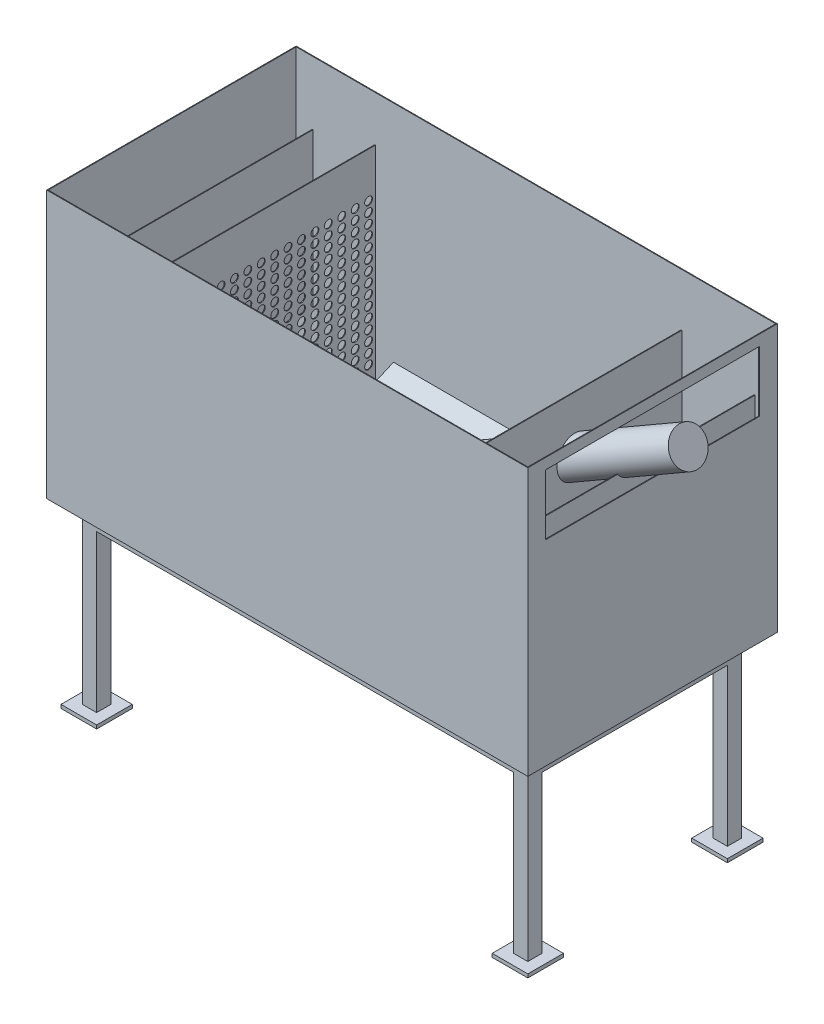
from build123d import *

# Parameters (mm, degrees)
MASTER_FOOTPRINT_W                  = 1350
MASTER_FOOTPRINT_H                  = 700
BATH_BASE_PLATE_DEPTH               = 750
BATH_SHELL_2MM_T                    = -2
SKETCH_1_R                          = 50
INLET_D100_OPENING_DEPTH            = 10
INLET_IMPACT_BAFFLE_START           = 125
SKETCH_2_W                          = 540
SKETCH_2_H                          = 430
INLET_IMPACT_BAFFLE_DEPTH           = 2
DISTRIBUTOR_D22_START               = 250
SKETCH_3_W                          = 640
SKETCH_3_H                          = 648
SKETCH_3_R                          = 11
DISTRIBUTOR_D22_DEPTH               = 2
OUTLET_SUBMERGED_BAFFLE_START       = 1130
SKETCH_4_W                          = 600
SKETCH_4_H                          = 330
OUTLET_SUBMERGED_BAFFLE_DEPTH       = 2
OVERFLOW_WEIR_Z550_START            = 1290
SKETCH_5_W                          = 690
SKETCH_5_H                          = 548
OVERFLOW_WEIR_Z550_DEPTH            = 2
OUTLET_WEIR_SLOT_W600_START         = 1345
SKETCH_6_W                          = 600
SKETCH_6_H                          = 170
OUTLET_WEIR_SLOT_W600_DEPTH         = 10
SLOPED_SEDIMENT_FLOOR_START         = 275
SLOPED_SEDIMENT_FLOOR_DEPTH         = 825
SKETCH_8_W                          = 40
SKETCH_8_H                          = 40
FRAME_LEGS_40X40_H500_DEPTH         = 500
FRAME_LONGITUDINAL_RAILS_START      = -20
SKETCH_9_W                          = 1250
SKETCH_9_H                          = 40
FRAME_LONGITUDINAL_RAILS_DEPTH      = 40
FRAME_TRANSVERSE_RAILS_START        = -20
SKETCH_10_W                         = 40
SKETCH_10_H                         = 520
FRAME_TRANSVERSE_RAILS_DEPTH        = 40
FRAME_FOOT_PADS_100X100_START       = -500
SKETCH_11_W                         = 100
SKETCH_11_H                         = 100
FRAME_FOOT_PADS_100X100_DEPTH       = 10
SCREW_OUTER_ENVELOPE_D100_PROFILE_R = 50


with BuildPart() as part:
    # MASTER_FOOTPRINT → BATH_BASE_PLATE (new body)
    with BuildSketch(Plane(origin=(0, 0, 0), x_dir=(1, 0, 0), z_dir=(0, 1, 0))):
        with Locations((675, 350)):
            Rectangle(MASTER_FOOTPRINT_W, MASTER_FOOTPRINT_H)
    extrude(amount=BATH_BASE_PLATE_DEPTH)

    # BATH_SHELL_2MM
    bath_shell_2mm_openings = [part.faces().sort_by_distance(p)[0] for p in [
        (675, 750, -350),
    ]]
    offset(amount=BATH_SHELL_2MM_T, openings=bath_shell_2mm_openings, kind=Kind.INTERSECTION)

    # Эскиз1 → INLET_D100_OPENING (cut)
    with BuildSketch(Plane(origin=(0, 0, 0), x_dir=(0, 0, -1), z_dir=(1, 0, 0))):
        with Locations((350, 420)):
            Circle(SKETCH_1_R)
    extrude(amount=INLET_D100_OPENING_DEPTH, mode=Mode.SUBTRACT)

    # Эскиз6 → OUTLET_WEIR_SLOT_W600 (cut)
    with BuildSketch(Plane(origin=(0, 0, 0), x_dir=(0, 0, -1), z_dir=(1, 0, 0)).offset(OUTLET_WEIR_SLOT_W600_START)):
        with Locations((350, 635)):
            Rectangle(SKETCH_6_W, SKETCH_6_H)
    extrude(amount=OUTLET_WEIR_SLOT_W600_DEPTH, mode=Mode.SUBTRACT)

    # Эскиз7 → SLOPED_SEDIMENT_FLOOR (add)
    with BuildSketch(Plane(origin=(0, 0, 0), x_dir=(0, 0, -1), z_dir=(1, 0, 0)).offset(SLOPED_SEDIMENT_FLOOR_START)):
        Polygon((2, -1), (2, 120), (280, -1), align=None)
        Polygon((698, -1), (698, 120), (420, -1), align=None)
    extrude(amount=SLOPED_SEDIMENT_FLOOR_DEPTH)

    # Эскиз8 → FRAME_LEGS_40X40_H500 (add)
    with BuildSketch(Plane(origin=(0, 0, 0), x_dir=(1, 0, 0), z_dir=(0, 1, 0))):
        with Locations((70, 70)):
            Rectangle(SKETCH_8_W, SKETCH_8_H)
        with Locations((70, 630)):
            Rectangle(SKETCH_8_W, SKETCH_8_H)
        with Locations((1280, 70)):
            Rectangle(SKETCH_8_W, SKETCH_8_H)
        with Locations((1280, 630)):
            Rectangle(SKETCH_8_W, SKETCH_8_H)
    extrude(amount=-FRAME_LEGS_40X40_H500_DEPTH)

    # Эскиз9 → FRAME_LONGITUDINAL_RAILS (add)
    with BuildSketch(Plane(origin=(0, 0, 0), x_dir=(1, 0, 0), z_dir=(0, 1, 0)).offset(FRAME_LONGITUDINAL_RAILS_START)):
        with Locations((675, 70)):
            Rectangle(SKETCH_9_W, SKETCH_9_H)
        with Locations((675, 630)):
            Rectangle(SKETCH_9_W, SKETCH_9_H)
    extrude(amount=-FRAME_LONGITUDINAL_RAILS_DEPTH)

    # Эскиз10 → FRAME_TRANSVERSE_RAILS (add)
    with BuildSketch(Plane(origin=(0, 0, 0), x_dir=(1, 0, 0), z_dir=(0, 1, 0)).offset(FRAME_TRANSVERSE_RAILS_START)):
        with Locations((70, 350)):
            Rectangle(SKETCH_10_W, SKETCH_10_H)
        with Locations((1280, 350)):
            Rectangle(SKETCH_10_W, SKETCH_10_H)
    extrude(amount=-FRAME_TRANSVERSE_RAILS_DEPTH)

    # Эскиз11 → FRAME_FOOT_PADS_100X100 (add)
    with BuildSketch(Plane(origin=(0, 0, 0), x_dir=(1, 0, 0), z_dir=(0, 1, 0)).offset(FRAME_FOOT_PADS_100X100_START)):
        with Locations((70, 70)):
            Rectangle(SKETCH_11_W, SKETCH_11_H)
        with Locations((70, 630)):
            Rectangle(SKETCH_11_W, SKETCH_11_H)
        with Locations((1280, 70)):
            Rectangle(SKETCH_11_W, SKETCH_11_H)
        with Locations((1280, 630)):
            Rectangle(SKETCH_11_W, SKETCH_11_H)
    extrude(amount=-FRAME_FOOT_PADS_100X100_DEPTH)


with BuildPart() as body_2:
    # Эскиз2 → INLET_IMPACT_BAFFLE (new body)
    with BuildSketch(Plane(origin=(0, 0, 0), x_dir=(0, 0, -1), z_dir=(1, 0, 0)).offset(INLET_IMPACT_BAFFLE_START)):
        with Locations((350, 435)):
            Rectangle(SKETCH_2_W, SKETCH_2_H)
    extrude(amount=INLET_IMPACT_BAFFLE_DEPTH)


with BuildPart() as body_3:
    # Эскиз3 → DISTRIBUTOR_D22 (new body)
    with BuildSketch(Plane(origin=(0, 0, 0), x_dir=(0, 0, -1), z_dir=(1, 0, 0)).offset(DISTRIBUTOR_D22_START)):
        with Locations((350, 326)):
            Rectangle(SKETCH_3_W, SKETCH_3_H)
        with Locations((48.823529412, 125)):
            Circle(SKETCH_3_R, mode=Mode.SUBTRACT)
        with Locations((48.823529412, 153.5)):
            Circle(SKETCH_3_R, mode=Mode.SUBTRACT)
        with Locations((48.823529412, 182)):
            Circle(SKETCH_3_R, mode=Mode.SUBTRACT)
        with Locations((48.823529412, 210.5)):
            Circle(SKETCH_3_R, mode=Mode.SUBTRACT)
        with Locations((48.823529412, 239)):
            Circle(SKETCH_3_R, mode=Mode.SUBTRACT)
        with Locations((48.823529412, 267.5)):
            Circle(SKETCH_3_R, mode=Mode.SUBTRACT)
        with Locations((48.823529412, 296)):
            Circle(SKETCH_3_R, mode=Mode.SUBTRACT)
        with Locations((48.823529412, 324.5)):
            Circle(SKETCH_3_R, mode=Mode.SUBTRACT)
        with Locations((48.823529412, 353)):
            Circle(SKETCH_3_R, mode=Mode.SUBTRACT)
        with Locations((48.823529412, 381.5)):
            Circle(SKETCH_3_R, mode=Mode.SUBTRACT)
        with Locations((48.823529412, 410)):
            Circle(SKETCH_3_R, mode=Mode.SUBTRACT)
        with Locations((48.823529412, 438.5)):
            Circle(SKETCH_3_R, mode=Mode.SUBTRACT)
        with Locations((48.823529412, 467)):
            Circle(SKETCH_3_R, mode=Mode.SUBTRACT)
        with Locations((48.823529412, 495.5)):
            Circle(SKETCH_3_R, mode=Mode.SUBTRACT)
        with Locations((48.823529412, 524)):
            Circle(SKETCH_3_R, mode=Mode.SUBTRACT)
        with Locations((86.470588235, 125)):
            Circle(SKETCH_3_R, mode=Mode.SUBTRACT)
        with Locations((86.470588235, 153.5)):
            Circle(SKETCH_3_R, mode=Mode.SUBTRACT)
        with Locations((86.470588235, 182)):
            Circle(SKETCH_3_R, mode=Mode.SUBTRACT)
        with Locations((86.470588235, 210.5)):
            Circle(SKETCH_3_R, mode=Mode.SUBTRACT)
        with Locations((86.470588235, 239)):
            Circle(SKETCH_3_R, mode=Mode.SUBTRACT)
        with Locations((86.470588235, 267.5)):
            Circle(SKETCH_3_R, mode=Mode.SUBTRACT)
        with Locations((86.470588235, 296)):
            Circle(SKETCH_3_R, mode=Mode.SUBTRACT)
        with Locations((86.470588235, 324.5)):
            Circle(SKETCH_3_R, mode=Mode.SUBTRACT)
        with Locations((86.470588235, 353)):
            Circle(SKETCH_3_R, mode=Mode.SUBTRACT)
        with Locations((86.470588235, 381.5)):
            Circle(SKETCH_3_R, mode=Mode.SUBTRACT)
        with Locations((86.470588235, 410)):
            Circle(SKETCH_3_R, mode=Mode.SUBTRACT)
        with Locations((86.470588235, 438.5)):
            Circle(SKETCH_3_R, mode=Mode.SUBTRACT)
        with Locations((86.470588235, 467)):
            Circle(SKETCH_3_R, mode=Mode.SUBTRACT)
        with Locations((86.470588235, 495.5)):
            Circle(SKETCH_3_R, mode=Mode.SUBTRACT)
        with Locations((86.470588235, 524)):
            Circle(SKETCH_3_R, mode=Mode.SUBTRACT)
        with Locations((124.117647059, 125)):
            Circle(SKETCH_3_R, mode=Mode.SUBTRACT)
        with Locations((124.117647059, 153.5)):
            Circle(SKETCH_3_R, mode=Mode.SUBTRACT)
        with Locations((124.117647059, 182)):
            Circle(SKETCH_3_R, mode=Mode.SUBTRACT)
        with Locations((124.117647059, 210.5)):
            Circle(SKETCH_3_R, mode=Mode.SUBTRACT)
        with Locations((124.117647059, 239)):
            Circle(SKETCH_3_R, mode=Mode.SUBTRACT)
        with Locations((124.117647059, 267.5)):
            Circle(SKETCH_3_R, mode=Mode.SUBTRACT)
        with Locations((124.117647059, 296)):
            Circle(SKETCH_3_R, mode=Mode.SUBTRACT)
        with Locations((124.117647059, 324.5)):
            Circle(SKETCH_3_R, mode=Mode.SUBTRACT)
        with Locations((124.117647059, 353)):
            Circle(SKETCH_3_R, mode=Mode.SUBTRACT)
        with Locations((124.117647059, 381.5)):
            Circle(SKETCH_3_R, mode=Mode.SUBTRACT)
        with Locations((124.117647059, 410)):
            Circle(SKETCH_3_R, mode=Mode.SUBTRACT)
        with Locations((124.117647059, 438.5)):
            Circle(SKETCH_3_R, mode=Mode.SUBTRACT)
        with Locations((124.117647059, 467)):
            Circle(SKETCH_3_R, mode=Mode.SUBTRACT)
        with Locations((124.117647059, 495.5)):
            Circle(SKETCH_3_R, mode=Mode.SUBTRACT)
        with Locations((124.117647059, 524)):
            Circle(SKETCH_3_R, mode=Mode.SUBTRACT)
        with Locations((161.764705882, 125)):
            Circle(SKETCH_3_R, mode=Mode.SUBTRACT)
        with Locations((161.764705882, 153.5)):
            Circle(SKETCH_3_R, mode=Mode.SUBTRACT)
        with Locations((161.764705882, 182)):
            Circle(SKETCH_3_R, mode=Mode.SUBTRACT)
        with Locations((161.764705882, 210.5)):
            Circle(SKETCH_3_R, mode=Mode.SUBTRACT)
        with Locations((161.764705882, 239)):
            Circle(SKETCH_3_R, mode=Mode.SUBTRACT)
        with Locations((161.764705882, 267.5)):
            Circle(SKETCH_3_R, mode=Mode.SUBTRACT)
        with Locations((161.764705882, 296)):
            Circle(SKETCH_3_R, mode=Mode.SUBTRACT)
        with Locations((161.764705882, 324.5)):
            Circle(SKETCH_3_R, mode=Mode.SUBTRACT)
        with Locations((161.764705882, 353)):
            Circle(SKETCH_3_R, mode=Mode.SUBTRACT)
        with Locations((161.764705882, 381.5)):
            Circle(SKETCH_3_R, mode=Mode.SUBTRACT)
        with Locations((161.764705882, 410)):
            Circle(SKETCH_3_R, mode=Mode.SUBTRACT)
        with Locations((161.764705882, 438.5)):
            Circle(SKETCH_3_R, mode=Mode.SUBTRACT)
        with Locations((161.764705882, 467)):
            Circle(SKETCH_3_R, mode=Mode.SUBTRACT)
        with Locations((161.764705882, 495.5)):
            Circle(SKETCH_3_R, mode=Mode.SUBTRACT)
        with Locations((161.764705882, 524)):
            Circle(SKETCH_3_R, mode=Mode.SUBTRACT)
        with Locations((199.411764706, 125)):
            Circle(SKETCH_3_R, mode=Mode.SUBTRACT)
        with Locations((199.411764706, 153.5)):
            Circle(SKETCH_3_R, mode=Mode.SUBTRACT)
        with Locations((199.411764706, 182)):
            Circle(SKETCH_3_R, mode=Mode.SUBTRACT)
        with Locations((199.411764706, 210.5)):
            Circle(SKETCH_3_R, mode=Mode.SUBTRACT)
        with Locations((199.411764706, 239)):
            Circle(SKETCH_3_R, mode=Mode.SUBTRACT)
        with Locations((199.411764706, 267.5)):
            Circle(SKETCH_3_R, mode=Mode.SUBTRACT)
        with Locations((199.411764706, 296)):
            Circle(SKETCH_3_R, mode=Mode.SUBTRACT)
        with Locations((199.411764706, 324.5)):
            Circle(SKETCH_3_R, mode=Mode.SUBTRACT)
        with Locations((199.411764706, 353)):
            Circle(SKETCH_3_R, mode=Mode.SUBTRACT)
        with Locations((199.411764706, 381.5)):
            Circle(SKETCH_3_R, mode=Mode.SUBTRACT)
        with Locations((199.411764706, 410)):
            Circle(SKETCH_3_R, mode=Mode.SUBTRACT)
        with Locations((199.411764706, 438.5)):
            Circle(SKETCH_3_R, mode=Mode.SUBTRACT)
        with Locations((199.411764706, 467)):
            Circle(SKETCH_3_R, mode=Mode.SUBTRACT)
        with Locations((199.411764706, 495.5)):
            Circle(SKETCH_3_R, mode=Mode.SUBTRACT)
        with Locations((199.411764706, 524)):
            Circle(SKETCH_3_R, mode=Mode.SUBTRACT)
        with Locations((237.058823529, 125)):
            Circle(SKETCH_3_R, mode=Mode.SUBTRACT)
        with Locations((237.058823529, 153.5)):
            Circle(SKETCH_3_R, mode=Mode.SUBTRACT)
        with Locations((237.058823529, 182)):
            Circle(SKETCH_3_R, mode=Mode.SUBTRACT)
        with Locations((237.058823529, 210.5)):
            Circle(SKETCH_3_R, mode=Mode.SUBTRACT)
        with Locations((237.058823529, 239)):
            Circle(SKETCH_3_R, mode=Mode.SUBTRACT)
        with Locations((237.058823529, 267.5)):
            Circle(SKETCH_3_R, mode=Mode.SUBTRACT)
        with Locations((237.058823529, 296)):
            Circle(SKETCH_3_R, mode=Mode.SUBTRACT)
        with Locations((237.058823529, 324.5)):
            Circle(SKETCH_3_R, mode=Mode.SUBTRACT)
        with Locations((237.058823529, 353)):
            Circle(SKETCH_3_R, mode=Mode.SUBTRACT)
        with Locations((237.058823529, 381.5)):
            Circle(SKETCH_3_R, mode=Mode.SUBTRACT)
        with Locations((237.058823529, 410)):
            Circle(SKETCH_3_R, mode=Mode.SUBTRACT)
        with Locations((237.058823529, 438.5)):
            Circle(SKETCH_3_R, mode=Mode.SUBTRACT)
        with Locations((237.058823529, 467)):
            Circle(SKETCH_3_R, mode=Mode.SUBTRACT)
        with Locations((237.058823529, 495.5)):
            Circle(SKETCH_3_R, mode=Mode.SUBTRACT)
        with Locations((237.058823529, 524)):
            Circle(SKETCH_3_R, mode=Mode.SUBTRACT)
        with Locations((274.705882353, 125)):
            Circle(SKETCH_3_R, mode=Mode.SUBTRACT)
        with Locations((274.705882353, 153.5)):
            Circle(SKETCH_3_R, mode=Mode.SUBTRACT)
        with Locations((274.705882353, 182)):
            Circle(SKETCH_3_R, mode=Mode.SUBTRACT)
        with Locations((274.705882353, 210.5)):
            Circle(SKETCH_3_R, mode=Mode.SUBTRACT)
        with Locations((274.705882353, 239)):
            Circle(SKETCH_3_R, mode=Mode.SUBTRACT)
        with Locations((274.705882353, 267.5)):
            Circle(SKETCH_3_R, mode=Mode.SUBTRACT)
        with Locations((274.705882353, 296)):
            Circle(SKETCH_3_R, mode=Mode.SUBTRACT)
        with Locations((274.705882353, 324.5)):
            Circle(SKETCH_3_R, mode=Mode.SUBTRACT)
        with Locations((274.705882353, 353)):
            Circle(SKETCH_3_R, mode=Mode.SUBTRACT)
        with Locations((274.705882353, 381.5)):
            Circle(SKETCH_3_R, mode=Mode.SUBTRACT)
        with Locations((274.705882353, 410)):
            Circle(SKETCH_3_R, mode=Mode.SUBTRACT)
        with Locations((274.705882353, 438.5)):
            Circle(SKETCH_3_R, mode=Mode.SUBTRACT)
        with Locations((274.705882353, 467)):
            Circle(SKETCH_3_R, mode=Mode.SUBTRACT)
        with Locations((274.705882353, 495.5)):
            Circle(SKETCH_3_R, mode=Mode.SUBTRACT)
        with Locations((274.705882353, 524)):
            Circle(SKETCH_3_R, mode=Mode.SUBTRACT)
        with Locations((312.352941176, 125)):
            Circle(SKETCH_3_R, mode=Mode.SUBTRACT)
        with Locations((312.352941176, 153.5)):
            Circle(SKETCH_3_R, mode=Mode.SUBTRACT)
        with Locations((312.352941176, 182)):
            Circle(SKETCH_3_R, mode=Mode.SUBTRACT)
        with Locations((312.352941176, 210.5)):
            Circle(SKETCH_3_R, mode=Mode.SUBTRACT)
        with Locations((312.352941176, 239)):
            Circle(SKETCH_3_R, mode=Mode.SUBTRACT)
        with Locations((312.352941176, 267.5)):
            Circle(SKETCH_3_R, mode=Mode.SUBTRACT)
        with Locations((312.352941176, 296)):
            Circle(SKETCH_3_R, mode=Mode.SUBTRACT)
        with Locations((312.352941176, 324.5)):
            Circle(SKETCH_3_R, mode=Mode.SUBTRACT)
        with Locations((312.352941176, 353)):
            Circle(SKETCH_3_R, mode=Mode.SUBTRACT)
        with Locations((312.352941176, 381.5)):
            Circle(SKETCH_3_R, mode=Mode.SUBTRACT)
        with Locations((312.352941176, 410)):
            Circle(SKETCH_3_R, mode=Mode.SUBTRACT)
        with Locations((312.352941176, 438.5)):
            Circle(SKETCH_3_R, mode=Mode.SUBTRACT)
        with Locations((312.352941176, 467)):
            Circle(SKETCH_3_R, mode=Mode.SUBTRACT)
        with Locations((312.352941176, 495.5)):
            Circle(SKETCH_3_R, mode=Mode.SUBTRACT)
        with Locations((312.352941176, 524)):
            Circle(SKETCH_3_R, mode=Mode.SUBTRACT)
        with Locations((350, 125)):
            Circle(SKETCH_3_R, mode=Mode.SUBTRACT)
        with Locations((350, 153.5)):
            Circle(SKETCH_3_R, mode=Mode.SUBTRACT)
        with Locations((350, 182)):
            Circle(SKETCH_3_R, mode=Mode.SUBTRACT)
        with Locations((350, 210.5)):
            Circle(SKETCH_3_R, mode=Mode.SUBTRACT)
        with Locations((350, 239)):
            Circle(SKETCH_3_R, mode=Mode.SUBTRACT)
        with Locations((350, 267.5)):
            Circle(SKETCH_3_R, mode=Mode.SUBTRACT)
        with Locations((350, 296)):
            Circle(SKETCH_3_R, mode=Mode.SUBTRACT)
        with Locations((350, 324.5)):
            Circle(SKETCH_3_R, mode=Mode.SUBTRACT)
        with Locations((350, 353)):
            Circle(SKETCH_3_R, mode=Mode.SUBTRACT)
        with Locations((350, 381.5)):
            Circle(SKETCH_3_R, mode=Mode.SUBTRACT)
        with Locations((350, 410)):
            Circle(SKETCH_3_R, mode=Mode.SUBTRACT)
        with Locations((350, 438.5)):
            Circle(SKETCH_3_R, mode=Mode.SUBTRACT)
        with Locations((350, 467)):
            Circle(SKETCH_3_R, mode=Mode.SUBTRACT)
        with Locations((350, 495.5)):
            Circle(SKETCH_3_R, mode=Mode.SUBTRACT)
        with Locations((350, 524)):
            Circle(SKETCH_3_R, mode=Mode.SUBTRACT)
        with Locations((387.647058824, 125)):
            Circle(SKETCH_3_R, mode=Mode.SUBTRACT)
        with Locations((387.647058824, 153.5)):
            Circle(SKETCH_3_R, mode=Mode.SUBTRACT)
        with Locations((387.647058824, 182)):
            Circle(SKETCH_3_R, mode=Mode.SUBTRACT)
        with Locations((387.647058824, 210.5)):
            Circle(SKETCH_3_R, mode=Mode.SUBTRACT)
        with Locations((387.647058824, 239)):
            Circle(SKETCH_3_R, mode=Mode.SUBTRACT)
        with Locations((387.647058824, 267.5)):
            Circle(SKETCH_3_R, mode=Mode.SUBTRACT)
        with Locations((387.647058824, 296)):
            Circle(SKETCH_3_R, mode=Mode.SUBTRACT)
        with Locations((387.647058824, 324.5)):
            Circle(SKETCH_3_R, mode=Mode.SUBTRACT)
        with Locations((387.647058824, 353)):
            Circle(SKETCH_3_R, mode=Mode.SUBTRACT)
        with Locations((387.647058824, 381.5)):
            Circle(SKETCH_3_R, mode=Mode.SUBTRACT)
        with Locations((387.647058824, 410)):
            Circle(SKETCH_3_R, mode=Mode.SUBTRACT)
        with Locations((387.647058824, 438.5)):
            Circle(SKETCH_3_R, mode=Mode.SUBTRACT)
        with Locations((387.647058824, 467)):
            Circle(SKETCH_3_R, mode=Mode.SUBTRACT)
        with Locations((387.647058824, 495.5)):
            Circle(SKETCH_3_R, mode=Mode.SUBTRACT)
        with Locations((387.647058824, 524)):
            Circle(SKETCH_3_R, mode=Mode.SUBTRACT)
        with Locations((425.294117647, 125)):
            Circle(SKETCH_3_R, mode=Mode.SUBTRACT)
        with Locations((425.294117647, 153.5)):
            Circle(SKETCH_3_R, mode=Mode.SUBTRACT)
        with Locations((425.294117647, 182)):
            Circle(SKETCH_3_R, mode=Mode.SUBTRACT)
        with Locations((425.294117647, 210.5)):
            Circle(SKETCH_3_R, mode=Mode.SUBTRACT)
        with Locations((425.294117647, 239)):
            Circle(SKETCH_3_R, mode=Mode.SUBTRACT)
        with Locations((425.294117647, 267.5)):
            Circle(SKETCH_3_R, mode=Mode.SUBTRACT)
        with Locations((425.294117647, 296)):
            Circle(SKETCH_3_R, mode=Mode.SUBTRACT)
        with Locations((425.294117647, 324.5)):
            Circle(SKETCH_3_R, mode=Mode.SUBTRACT)
        with Locations((425.294117647, 353)):
            Circle(SKETCH_3_R, mode=Mode.SUBTRACT)
        with Locations((425.294117647, 381.5)):
            Circle(SKETCH_3_R, mode=Mode.SUBTRACT)
        with Locations((425.294117647, 410)):
            Circle(SKETCH_3_R, mode=Mode.SUBTRACT)
        with Locations((425.294117647, 438.5)):
            Circle(SKETCH_3_R, mode=Mode.SUBTRACT)
        with Locations((425.294117647, 467)):
            Circle(SKETCH_3_R, mode=Mode.SUBTRACT)
        with Locations((425.294117647, 495.5)):
            Circle(SKETCH_3_R, mode=Mode.SUBTRACT)
        with Locations((425.294117647, 524)):
            Circle(SKETCH_3_R, mode=Mode.SUBTRACT)
        with Locations((462.941176471, 125)):
            Circle(SKETCH_3_R, mode=Mode.SUBTRACT)
        with Locations((462.941176471, 153.5)):
            Circle(SKETCH_3_R, mode=Mode.SUBTRACT)
        with Locations((462.941176471, 182)):
            Circle(SKETCH_3_R, mode=Mode.SUBTRACT)
        with Locations((462.941176471, 210.5)):
            Circle(SKETCH_3_R, mode=Mode.SUBTRACT)
        with Locations((462.941176471, 239)):
            Circle(SKETCH_3_R, mode=Mode.SUBTRACT)
        with Locations((462.941176471, 267.5)):
            Circle(SKETCH_3_R, mode=Mode.SUBTRACT)
        with Locations((462.941176471, 296)):
            Circle(SKETCH_3_R, mode=Mode.SUBTRACT)
        with Locations((462.941176471, 324.5)):
            Circle(SKETCH_3_R, mode=Mode.SUBTRACT)
        with Locations((462.941176471, 353)):
            Circle(SKETCH_3_R, mode=Mode.SUBTRACT)
        with Locations((462.941176471, 381.5)):
            Circle(SKETCH_3_R, mode=Mode.SUBTRACT)
        with Locations((462.941176471, 410)):
            Circle(SKETCH_3_R, mode=Mode.SUBTRACT)
        with Locations((462.941176471, 438.5)):
            Circle(SKETCH_3_R, mode=Mode.SUBTRACT)
        with Locations((462.941176471, 467)):
            Circle(SKETCH_3_R, mode=Mode.SUBTRACT)
        with Locations((462.941176471, 495.5)):
            Circle(SKETCH_3_R, mode=Mode.SUBTRACT)
        with Locations((462.941176471, 524)):
            Circle(SKETCH_3_R, mode=Mode.SUBTRACT)
        with Locations((500.588235294, 125)):
            Circle(SKETCH_3_R, mode=Mode.SUBTRACT)
        with Locations((500.588235294, 153.5)):
            Circle(SKETCH_3_R, mode=Mode.SUBTRACT)
        with Locations((500.588235294, 182)):
            Circle(SKETCH_3_R, mode=Mode.SUBTRACT)
        with Locations((500.588235294, 210.5)):
            Circle(SKETCH_3_R, mode=Mode.SUBTRACT)
        with Locations((500.588235294, 239)):
            Circle(SKETCH_3_R, mode=Mode.SUBTRACT)
        with Locations((500.588235294, 267.5)):
            Circle(SKETCH_3_R, mode=Mode.SUBTRACT)
        with Locations((500.588235294, 296)):
            Circle(SKETCH_3_R, mode=Mode.SUBTRACT)
        with Locations((500.588235294, 324.5)):
            Circle(SKETCH_3_R, mode=Mode.SUBTRACT)
        with Locations((500.588235294, 353)):
            Circle(SKETCH_3_R, mode=Mode.SUBTRACT)
        with Locations((500.588235294, 381.5)):
            Circle(SKETCH_3_R, mode=Mode.SUBTRACT)
        with Locations((500.588235294, 410)):
            Circle(SKETCH_3_R, mode=Mode.SUBTRACT)
        with Locations((500.588235294, 438.5)):
            Circle(SKETCH_3_R, mode=Mode.SUBTRACT)
        with Locations((500.588235294, 467)):
            Circle(SKETCH_3_R, mode=Mode.SUBTRACT)
        with Locations((500.588235294, 495.5)):
            Circle(SKETCH_3_R, mode=Mode.SUBTRACT)
        with Locations((500.588235294, 524)):
            Circle(SKETCH_3_R, mode=Mode.SUBTRACT)
        with Locations((538.235294118, 125)):
            Circle(SKETCH_3_R, mode=Mode.SUBTRACT)
        with Locations((538.235294118, 153.5)):
            Circle(SKETCH_3_R, mode=Mode.SUBTRACT)
        with Locations((538.235294118, 182)):
            Circle(SKETCH_3_R, mode=Mode.SUBTRACT)
        with Locations((538.235294118, 210.5)):
            Circle(SKETCH_3_R, mode=Mode.SUBTRACT)
        with Locations((538.235294118, 239)):
            Circle(SKETCH_3_R, mode=Mode.SUBTRACT)
        with Locations((538.235294118, 267.5)):
            Circle(SKETCH_3_R, mode=Mode.SUBTRACT)
        with Locations((538.235294118, 296)):
            Circle(SKETCH_3_R, mode=Mode.SUBTRACT)
        with Locations((538.235294118, 324.5)):
            Circle(SKETCH_3_R, mode=Mode.SUBTRACT)
        with Locations((538.235294118, 353)):
            Circle(SKETCH_3_R, mode=Mode.SUBTRACT)
        with Locations((538.235294118, 381.5)):
            Circle(SKETCH_3_R, mode=Mode.SUBTRACT)
        with Locations((538.235294118, 410)):
            Circle(SKETCH_3_R, mode=Mode.SUBTRACT)
        with Locations((538.235294118, 438.5)):
            Circle(SKETCH_3_R, mode=Mode.SUBTRACT)
        with Locations((538.235294118, 467)):
            Circle(SKETCH_3_R, mode=Mode.SUBTRACT)
        with Locations((538.235294118, 495.5)):
            Circle(SKETCH_3_R, mode=Mode.SUBTRACT)
        with Locations((538.235294118, 524)):
            Circle(SKETCH_3_R, mode=Mode.SUBTRACT)
        with Locations((575.882352941, 125)):
            Circle(SKETCH_3_R, mode=Mode.SUBTRACT)
        with Locations((575.882352941, 153.5)):
            Circle(SKETCH_3_R, mode=Mode.SUBTRACT)
        with Locations((575.882352941, 182)):
            Circle(SKETCH_3_R, mode=Mode.SUBTRACT)
        with Locations((575.882352941, 210.5)):
            Circle(SKETCH_3_R, mode=Mode.SUBTRACT)
        with Locations((575.882352941, 239)):
            Circle(SKETCH_3_R, mode=Mode.SUBTRACT)
        with Locations((575.882352941, 267.5)):
            Circle(SKETCH_3_R, mode=Mode.SUBTRACT)
        with Locations((575.882352941, 296)):
            Circle(SKETCH_3_R, mode=Mode.SUBTRACT)
        with Locations((575.882352941, 324.5)):
            Circle(SKETCH_3_R, mode=Mode.SUBTRACT)
        with Locations((575.882352941, 353)):
            Circle(SKETCH_3_R, mode=Mode.SUBTRACT)
        with Locations((575.882352941, 381.5)):
            Circle(SKETCH_3_R, mode=Mode.SUBTRACT)
        with Locations((575.882352941, 410)):
            Circle(SKETCH_3_R, mode=Mode.SUBTRACT)
        with Locations((575.882352941, 438.5)):
            Circle(SKETCH_3_R, mode=Mode.SUBTRACT)
        with Locations((575.882352941, 467)):
            Circle(SKETCH_3_R, mode=Mode.SUBTRACT)
        with Locations((575.882352941, 495.5)):
            Circle(SKETCH_3_R, mode=Mode.SUBTRACT)
        with Locations((575.882352941, 524)):
            Circle(SKETCH_3_R, mode=Mode.SUBTRACT)
        with Locations((613.529411765, 125)):
            Circle(SKETCH_3_R, mode=Mode.SUBTRACT)
        with Locations((613.529411765, 153.5)):
            Circle(SKETCH_3_R, mode=Mode.SUBTRACT)
        with Locations((613.529411765, 182)):
            Circle(SKETCH_3_R, mode=Mode.SUBTRACT)
        with Locations((613.529411765, 210.5)):
            Circle(SKETCH_3_R, mode=Mode.SUBTRACT)
        with Locations((613.529411765, 239)):
            Circle(SKETCH_3_R, mode=Mode.SUBTRACT)
        with Locations((613.529411765, 267.5)):
            Circle(SKETCH_3_R, mode=Mode.SUBTRACT)
        with Locations((613.529411765, 296)):
            Circle(SKETCH_3_R, mode=Mode.SUBTRACT)
        with Locations((613.529411765, 324.5)):
            Circle(SKETCH_3_R, mode=Mode.SUBTRACT)
        with Locations((613.529411765, 353)):
            Circle(SKETCH_3_R, mode=Mode.SUBTRACT)
        with Locations((613.529411765, 381.5)):
            Circle(SKETCH_3_R, mode=Mode.SUBTRACT)
        with Locations((613.529411765, 410)):
            Circle(SKETCH_3_R, mode=Mode.SUBTRACT)
        with Locations((613.529411765, 438.5)):
            Circle(SKETCH_3_R, mode=Mode.SUBTRACT)
        with Locations((613.529411765, 467)):
            Circle(SKETCH_3_R, mode=Mode.SUBTRACT)
        with Locations((613.529411765, 495.5)):
            Circle(SKETCH_3_R, mode=Mode.SUBTRACT)
        with Locations((613.529411765, 524)):
            Circle(SKETCH_3_R, mode=Mode.SUBTRACT)
        with Locations((651.176470588, 125)):
            Circle(SKETCH_3_R, mode=Mode.SUBTRACT)
        with Locations((651.176470588, 153.5)):
            Circle(SKETCH_3_R, mode=Mode.SUBTRACT)
        with Locations((651.176470588, 182)):
            Circle(SKETCH_3_R, mode=Mode.SUBTRACT)
        with Locations((651.176470588, 210.5)):
            Circle(SKETCH_3_R, mode=Mode.SUBTRACT)
        with Locations((651.176470588, 239)):
            Circle(SKETCH_3_R, mode=Mode.SUBTRACT)
        with Locations((651.176470588, 267.5)):
            Circle(SKETCH_3_R, mode=Mode.SUBTRACT)
        with Locations((651.176470588, 296)):
            Circle(SKETCH_3_R, mode=Mode.SUBTRACT)
        with Locations((651.176470588, 324.5)):
            Circle(SKETCH_3_R, mode=Mode.SUBTRACT)
        with Locations((651.176470588, 353)):
            Circle(SKETCH_3_R, mode=Mode.SUBTRACT)
        with Locations((651.176470588, 381.5)):
            Circle(SKETCH_3_R, mode=Mode.SUBTRACT)
        with Locations((651.176470588, 410)):
            Circle(SKETCH_3_R, mode=Mode.SUBTRACT)
        with Locations((651.176470588, 438.5)):
            Circle(SKETCH_3_R, mode=Mode.SUBTRACT)
        with Locations((651.176470588, 467)):
            Circle(SKETCH_3_R, mode=Mode.SUBTRACT)
        with Locations((651.176470588, 495.5)):
            Circle(SKETCH_3_R, mode=Mode.SUBTRACT)
        with Locations((651.176470588, 524)):
            Circle(SKETCH_3_R, mode=Mode.SUBTRACT)
    extrude(amount=DISTRIBUTOR_D22_DEPTH)


with BuildPart() as body_4:
    # Эскиз4 → OUTLET_SUBMERGED_BAFFLE (new body)
    with BuildSketch(Plane(origin=(0, 0, 0), x_dir=(0, 0, -1), z_dir=(1, 0, 0)).offset(OUTLET_SUBMERGED_BAFFLE_START)):
        with Locations((350, 485)):
            Rectangle(SKETCH_4_W, SKETCH_4_H)
    extrude(amount=OUTLET_SUBMERGED_BAFFLE_DEPTH)


with BuildPart() as body_5:
    # Эскиз5 → OVERFLOW_WEIR_Z550 (new body)
    with BuildSketch(Plane(origin=(0, 0, 0), x_dir=(0, 0, -1), z_dir=(1, 0, 0)).offset(OVERFLOW_WEIR_Z550_START)):
        with Locations((350, 276)):
            Rectangle(SKETCH_5_W, SKETCH_5_H)
    extrude(amount=OVERFLOW_WEIR_Z550_DEPTH)


with BuildPart() as body_6:
    # SCREW_OUTER_ENVELOPE_D100: sweep along a curve in space
    with BuildLine() as screw_outer_envelope_d100_path:
        Line((400, 70, -350), (1450, 676.217782649, -350))
    # SCREW_OUTER_ENVELOPE_D100 profile (on start of the path) → SCREW_OUTER_ENVELOPE_D100 (sweep)
    with BuildSketch(Plane(origin=(400, 70, -350), x_dir=(-0.5, 0.8660254037844387, 0), z_dir=(0.8660254037844387, 0.5, 0))):
        Circle(SCREW_OUTER_ENVELOPE_D100_PROFILE_R)
    sweep(path=screw_outer_envelope_d100_path.line)


solid = Compound([part.part, body_2.part, body_3.part, body_4.part, body_5.part, body_6.part])
